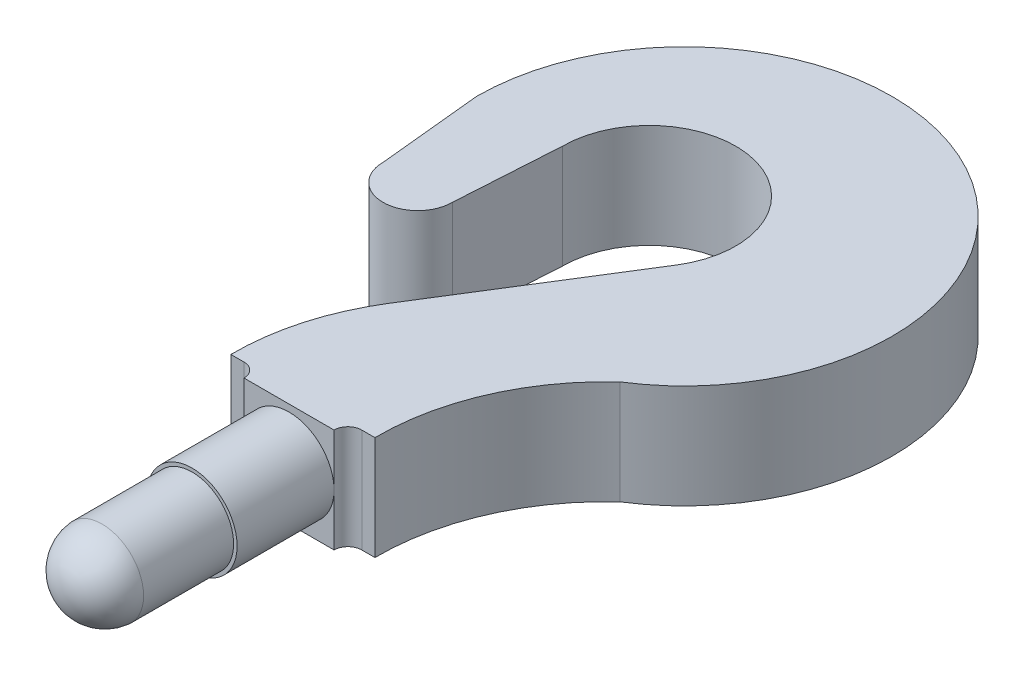
from build123d import *

# Parameters (mm, degrees)
SCHIZZO1_R                   = 6.5
ESTRUSIONE_ESTRUSIONE1_DEPTH = 14
SCHIZZO2_R                   = 6
ESTRUSIONE_ESTRUSIONE2_DEPTH = 13
CUPOLA1_FACE_RADIUS          = 6
CUPOLA1_HEIGHT               = 5.61
ESTRUSIONE_ESTRUSIONE3_DEPTH = 7.5
RACCORDO1_R                  = 2


with BuildPart() as part:
    # Schizzo1 → Estrusione-Estrusione1 (new body)
    with BuildSketch(Plane.XY):
        Circle(SCHIZZO1_R)
    extrude(amount=ESTRUSIONE_ESTRUSIONE1_DEPTH)

    # Schizzo2 → Estrusione-Estrusione2 (add)
    with BuildSketch(Plane.XY.offset(14)):
        with Locations(Location((0, 0, 0), (0, 0, 180))):
            Circle(SCHIZZO2_R)
    extrude(amount=ESTRUSIONE_ESTRUSIONE2_DEPTH)

    # Cupola1: a dome of height H over a round flat face of radius A is a cap of a sphere of radius (A * A + H * H) / (2 * H)
    cupola1_r = (CUPOLA1_FACE_RADIUS * CUPOLA1_FACE_RADIUS + CUPOLA1_HEIGHT * CUPOLA1_HEIGHT) / (2 * CUPOLA1_HEIGHT)
    cupola1_base = Plane((0, 0, 27), z_dir=(0, 0, 1))
    with Locations(cupola1_base.offset(CUPOLA1_HEIGHT - cupola1_r)):
        cupola1_ball = Sphere(cupola1_r, mode=Mode.PRIVATE)
    add(split(cupola1_ball, bisect_by=cupola1_base, keep=Keep.TOP, mode=Mode.PRIVATE))

    # Schizzo3 → Estrusione-Estrusione3 (add, symmetric)
    with BuildSketch(Plane(origin=(0, 0, 0), x_dir=(1, 0, 0), z_dir=(0, 1, 0))):
        with BuildLine():
            Line((-6.5, 2), (-6.5, 0))
            Line((-6.5, 0), (0, 0))
            Line((0, 0), (0, 28.411501065))
            Line((0, 28.411501065), (-5.385587173, 19.792759953))
            ThreePointArc((-5.385587173, 19.792759953), (-9.163389911, 11.254561696), (-10.398586576, 2))
            Line((-10.398586576, 2), (-6.5, 2))
        make_face()
        with BuildLine():
            Line((0, 28.411501065), (0, 0))
            Line((0, 0), (6.5, 0))
            Line((6.5, 0), (6.5, 2))
            Line((6.5, 2), (10.401413424, 2))
            ThreePointArc((10.401413424, 2), (13.142849654, 15.477548319), (21.139966273, 26.667092863))
            ThreePointArc((21.139966273, 26.667092863), (19.525120405, 78.287820261), (-24.93, 52))
            Line((-24.93, 52), (-24.335940594, 46.059405941))
            Line((-24.335940594, 46.059405941), (-23.43, 37))
            ThreePointArc((-23.43, 37), (-18.43, 32), (-13.43, 37))
            Line((-13.43, 37), (-12.5, 52))
            ThreePointArc((-12.5, 52), (3.445466948, 64.015771199), (10.600601202, 45.376009197))
            Line((10.600601202, 45.376009197), (0, 28.411501065))
        make_face()
    extrude(amount=ESTRUSIONE_ESTRUSIONE3_DEPTH, both=True)

    # Raccordo1
    raccordo1_edges = [part.edges().sort_by_distance(p)[0] for p in [
        (6.5, 0, -2),
        (-6.5, 0, -2),
    ]]
    fillet(raccordo1_edges, radius=RACCORDO1_R - 0.0001)  # a hair under: the kernel refuses the full size


solid = part.part
